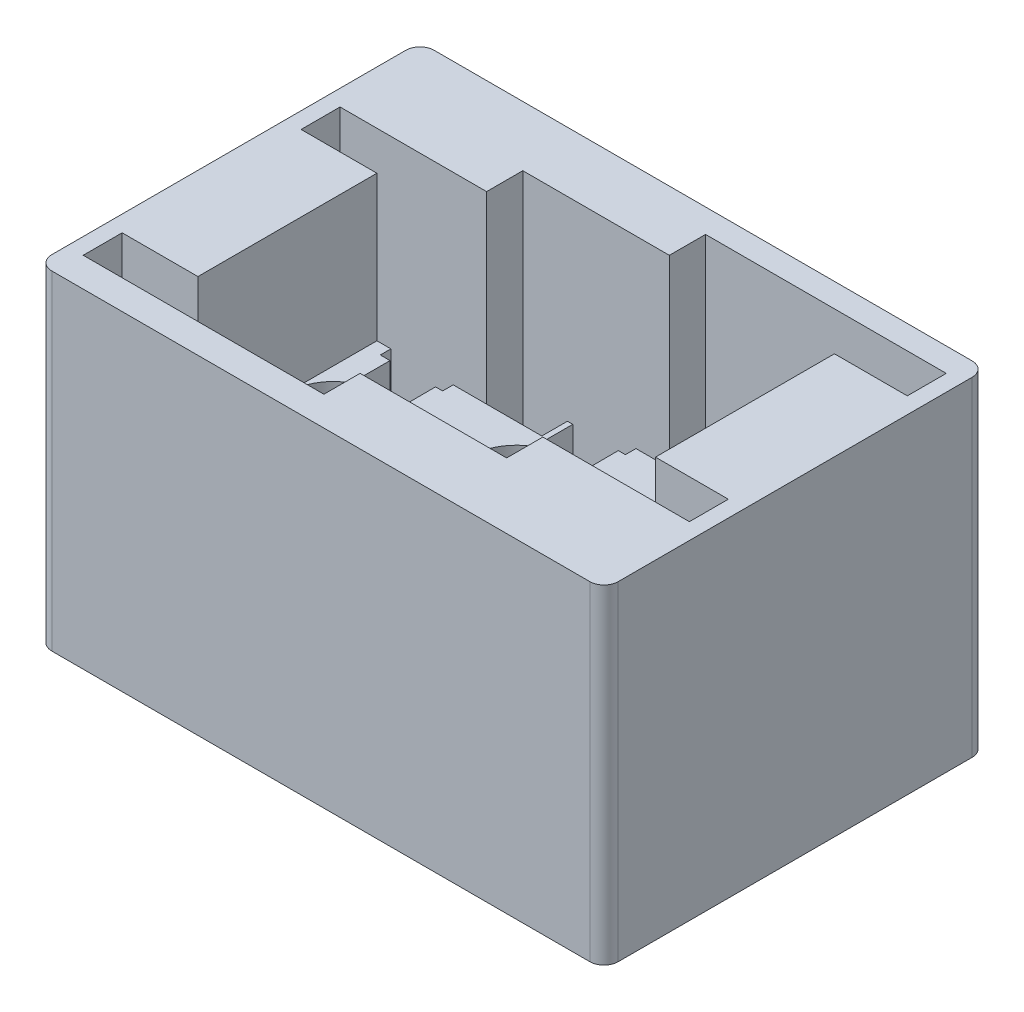
from build123d import *

# Parameters (mm, degrees)
SKETCH1_W                                 = 80
SKETCH1_H                                 = 54
BOSS_EXTRUDE2_DEPTH                       = 46.5
FILLET1_R                                 = 2
TIE_START                                 = 17.648406802
TIE_FIGHTER_LAYING_DOWN_BLANK_DEPTH       = 27
TIE_START_2                               = 3.648406802
TIE_FIGHTER_LAYING_DOWN_BLANK_2_OUTLINE_W = 5.5
TIE_FIGHTER_LAYING_DOWN_BLANK_2_OUTLINE_H = 34
TIE_FIGHTER_LAYING_DOWN_BLANK_2_DEPTH     = 14
TIE_START_3                               = 24.148406802
TIE_FIGHTER_LAYING_DOWN_BLANK_3_DEPTH     = 20.5
TIE_START_4                               = 10.648406802
TIE_FIGHTER_LAYING_DOWN_BLANK_4_OUTLINE_R = 2
TIE_FIGHTER_LAYING_DOWN_BLANK_4_DEPTH     = 7
BODY_MOVE_COPY3_ANGLE                     = 90
SKETCH2_W                                 = 7.700906033
SKETCH2_H                                 = 20.169020688
SKETCH2_W_2                               = 7.700906032
CUT_EXTRUDE1_DEPTH                        = 30
SKETCH3_R                                 = 4
CUT_EXTRUDE2_DEPTH                        = 17
SKETCH4_W                                 = 3.700906032
SKETCH4_H                                 = 16.169020688
SKETCH4_W_2                               = 8.420251913
SKETCH4_H_2                               = 21.281008515
SKETCH4_W_3                               = 8.999653324
SKETCH4_W_4                               = 3.700906033
CUT_EXTRUDE3_DEPTH                        = 27
FILLET2_R                                 = 2
SKETCH5_W                                 = 3.700906033
SKETCH5_H                                 = 16.169020688
SKETCH5_W_2                               = 3.700906032
BOSS_EXTRUDE3_DEPTH                       = 2
SKETCH6_R                                 = 4
CUT_EXTRUDE4_DEPTH                        = 11


with BuildPart() as part:
    # Sketch1 → Boss-Extrude2 (new body)
    with BuildSketch(Plane(origin=(0, 0, 0), x_dir=(1, 0, 0), z_dir=(0, 1, 0))):
        with Locations((40, 27)):
            Rectangle(SKETCH1_W, SKETCH1_H)
    extrude(amount=BOSS_EXTRUDE2_DEPTH)

    # Fillet1
    fillet1_edges = [part.edges().sort_by_distance(p)[0] for p in [
        (0, 23.25, -54),
        (80, 23.25, -54),
        (80, 23.25, 0),
        (0, 23.25, 0),
    ]]
    fillet(fillet1_edges, radius=FILLET1_R)


with BuildPart() as body_2:
    # Tie Fighter Laying Down Blank: read off the stored shape, not the designer's step
    # Tie Fighter Laying Down Blank outline → Tie Fighter Laying Down Blank (new body)
    with BuildSketch(Plane(origin=(0, 0, 0), x_dir=(1, 0, 0), z_dir=(0, 1, 0)).offset(TIE_START)):
        with BuildLine():
            Line((-37.161017612, 22.550360254), (-37.161017612, 23.550360254))
            Line((-37.161017612, 23.550360254), (-31.61325597, 23.529243987))
            ThreePointArc((-31.61325597, 23.529243987), (-26.013035095, 20.32886914), (-20.412814219, 23.529243987))
            Line((-20.412814219, 23.529243987), (-14.865052577, 23.550360254))
            Line((-14.865052577, 23.550360254), (-14.865052577, 22.550360254))
            Line((-14.865052577, 22.550360254), (-13.372530837, 22.550360254))
            Line((-13.372530837, 22.550360254), (-13.372530837, 10.033920638))
            Line((-13.372530837, 10.033920638), (-7.872530837, 10.033920638))
            Line((-7.872530837, 10.033920638), (-7.872530837, 44.033920638))
            Line((-7.872530837, 44.033920638), (-13.372530837, 44.033920638))
            Line((-13.372530837, 44.033920638), (-13.372530837, 31.354739987))
            Line((-13.372530837, 31.354739987), (-14.865052577, 31.354739987))
            Line((-14.865052577, 31.354739987), (-14.865052577, 29.979499621))
            Line((-14.865052577, 29.979499621), (-20.327656693, 29.979499621))
            ThreePointArc((-20.327656693, 29.979499621), (-26.013035095, 33.32886914), (-31.698413496, 29.979499621))
            Line((-31.698413496, 29.979499621), (-37.161017612, 29.979499621))
            Line((-37.161017612, 29.979499621), (-37.161017612, 31.354739987))
            Line((-37.161017612, 31.354739987), (-38.653539352, 31.354739987))
            Line((-38.653539352, 31.354739987), (-38.653539352, 44.033920638))
            Line((-38.653539352, 44.033920638), (-44.153539352, 44.033920638))
            Line((-44.153539352, 44.033920638), (-44.153539352, 10.033920638))
            Line((-44.153539352, 10.033920638), (-38.653539352, 10.033920638))
            Line((-38.653539352, 10.033920638), (-38.653539352, 22.550360254))
            Line((-38.653539352, 22.550360254), (-37.161017612, 22.550360254))
        make_face()
    extrude(amount=TIE_FIGHTER_LAYING_DOWN_BLANK_DEPTH)

    # Tie Fighter Laying Down Blank 2 outline → Tie Fighter Laying Down Blank 2 (add)
    with BuildSketch(Plane(origin=(0, 0, 0), x_dir=(1, 0, 0), z_dir=(0, 1, 0)).offset(TIE_START_2)):
        with Locations((-41.403539352, 27.033920638)):
            Rectangle(TIE_FIGHTER_LAYING_DOWN_BLANK_2_OUTLINE_W, TIE_FIGHTER_LAYING_DOWN_BLANK_2_OUTLINE_H)
        with Locations((-10.622530837, 27.033920638)):
            Rectangle(TIE_FIGHTER_LAYING_DOWN_BLANK_2_OUTLINE_W, TIE_FIGHTER_LAYING_DOWN_BLANK_2_OUTLINE_H)
    extrude(amount=TIE_FIGHTER_LAYING_DOWN_BLANK_2_DEPTH)

    # Tie Fighter Laying Down Blank 3 outline → Tie Fighter Laying Down Blank 3 (add)
    with BuildSketch(Plane(origin=(0, 0, 0), x_dir=(1, 0, 0), z_dir=(0, 1, 0)).offset(TIE_START_3)):
        with BuildLine():
            Line((-31.61325597, 23.529243987), (-37.161017612, 23.550360254))
            Line((-37.161017612, 23.550360254), (-37.161017612, 22.550360254))
            Line((-37.161017612, 22.550360254), (-38.653539352, 22.550360254))
            Line((-38.653539352, 22.550360254), (-38.653539352, 20.32886914))
            Line((-38.653539352, 20.32886914), (-26.013035094, 20.32886914))
            ThreePointArc((-26.013035094, 20.32886914), (-29.238127071, 21.18539665), (-31.61325597, 23.529243987))
        make_face()
        with BuildLine():
            ThreePointArc((-20.412814219, 23.529243987), (-22.787943118, 21.18539665), (-26.013035094, 20.32886914))
            Line((-26.013035094, 20.32886914), (-13.372530837, 20.32886914))
            Line((-13.372530837, 20.32886914), (-13.372530837, 22.550360254))
            Line((-13.372530837, 22.550360254), (-14.865052577, 22.550360254))
            Line((-14.865052577, 22.550360254), (-14.865052577, 23.550360254))
            Line((-14.865052577, 23.550360254), (-20.412814219, 23.529243987))
        make_face()
        with BuildLine():
            Line((-38.653539352, 33.32886914), (-38.653539352, 31.354739987))
            Line((-38.653539352, 31.354739987), (-37.161017612, 31.354739987))
            Line((-37.161017612, 31.354739987), (-37.161017612, 29.979499621))
            Line((-37.161017612, 29.979499621), (-31.698413496, 29.979499621))
            ThreePointArc((-31.698413496, 29.979499621), (-29.31234577, 32.429275292), (-26.013035095, 33.32886914))
            Line((-26.013035095, 33.32886914), (-38.653539352, 33.32886914))
        make_face()
        with BuildLine():
            Line((-13.372530837, 33.32886914), (-26.013035095, 33.32886914))
            ThreePointArc((-26.013035095, 33.32886914), (-22.713724419, 32.429275292), (-20.327656693, 29.979499621))
            Line((-20.327656693, 29.979499621), (-14.865052577, 29.979499621))
            Line((-14.865052577, 29.979499621), (-14.865052577, 31.354739987))
            Line((-14.865052577, 31.354739987), (-13.372530837, 31.354739987))
            Line((-13.372530837, 31.354739987), (-13.372530837, 33.32886914))
        make_face()
    extrude(amount=TIE_FIGHTER_LAYING_DOWN_BLANK_3_DEPTH)

    # Tie Fighter Laying Down Blank 4 outline → Tie Fighter Laying Down Blank 4 (add)
    with BuildSketch(Plane(origin=(0, 0, 0), x_dir=(1, 0, 0), z_dir=(0, 1, 0)).offset(TIE_START_4)):
        with Locations((-26.013035095, 26.82886914)):
            Circle(TIE_FIGHTER_LAYING_DOWN_BLANK_4_OUTLINE_R)
    extrude(amount=TIE_FIGHTER_LAYING_DOWN_BLANK_4_DEPTH)


with BuildPart() as body_2_1:
    # Body-Move/Copy2: read off the stored shape, not the designer's step
    # Body-Move/Copy2: moved
    add(body_2.part.moved(Location((0, 1.8515932, 0))))


with BuildPart() as body_2_2:
    # Body-Move/Copy3: moved
    add(body_2_1.part.rotate(Axis((-26.013075057, 0, -27.033920638), (0, 1, 0)), BODY_MOVE_COPY3_ANGLE))


with BuildPart() as body_2_3:
    # Body-Move/Copy4: moved
    add(body_2_2.part.moved(Location((45.307676883, 0, 6.774371597))))


with BuildPart() as body_3:
    # Body-Move/Copy6: read off the stored shape, not the designer's step
    # Body-Move/Copy6: copy of body 2
    add(body_2_3.part.moved(Location((41.4018121, 0, -10.2239757))))


with BuildPart() as body_4:
    # Body-Move_Copy6 2: copy of body 2
    add(body_2_3.part.moved(Location((20.700906, 0, -5.1119878))))


with BuildPart() as body_3_1:
    # Body-Move/Copy7: read off the stored shape, not the designer's step
    # Body-Move/Copy7: moved
    add(body_3.part.moved(Location((0, 0, -2.018363))))


with BuildPart() as body_4_1:
    # Body-Move_Copy7 2: moved
    add(body_4.part.moved(Location((0, 0, -2.018363))))


with BuildPart() as body_2_4:
    # Body-Move_Copy7 3: moved
    add(body_2_3.part.moved(Location((0, 0, -2.018363))))


with BuildPart() as part_1:
    add(part.part)

    # Intersect1: read off the stored shape, not the designer's step
    # Intersect1: cut body 3, body 4, body 2
    add(body_3_1.part, mode=Mode.SUBTRACT)
    add(body_4_1.part, mode=Mode.SUBTRACT)
    add(body_2_4.part, mode=Mode.SUBTRACT)

    # Sketch2 → Cut-Extrude1 (cut)
    with BuildSketch(Plane(origin=(0, 26, 0), x_dir=(1, 0, 0), z_dir=(0, 1, 0))):
        with Locations((29.850106341, 24.833945924)):
            Rectangle(SKETCH2_W, SKETCH2_H)
        with Locations((50.551012373, 29.945933752)):
            Rectangle(SKETCH2_W_2, SKETCH2_H)
    extrude(amount=CUT_EXTRUDE1_DEPTH, mode=Mode.SUBTRACT)

    # Sketch3 → Cut-Extrude2 (cut)
    # profile 1 of 3: a face of its own
    with BuildSketch(Plane.XZ):
        Polygon((38.294601826, -32.918456268), (2, -32.918456268), (2, -11.637447753), (20.995507859, -11.637447753), (20.995507859, -16.74943558), (41.696413892, -16.74943558), (41.696413892, -21.861423408), (78, -21.861423408), (78, -43.142431923), (58.995507859, -43.142431923), (58.995507859, -38.030444096), (38.294601826, -38.030444096), align=None)
        with Locations(Location((60.901465389, -32.501927666, 0), (0, 0, 270))):
            Circle(SKETCH3_R, mode=Mode.SUBTRACT)
        with Locations(Location((40.200559357, -27.389939838, 0), (0, 0, 270))):
            Circle(SKETCH3_R, mode=Mode.SUBTRACT)
        with Locations(Location((19.499653324, -22.277952011, 0), (0, 0, 270))):
            Circle(SKETCH3_R, mode=Mode.SUBTRACT)
    # profile 2 of 3: a face of its own
    with BuildSketch(Plane.XZ):
        Polygon((2.294601826, -42.418456268), (20.995507859, -42.418456268), (20.995507859, -47.530444096), (41.696413892, -47.530444096), (41.696413892, -50.642391961), (41.696413892, -52), (2, -52), (2, -42.418456268), align=None)
    # profile 3 of 3: a face of its own
    with BuildSketch(Plane.XZ):
        Polygon((77.696413892, -12.361423408), (58.995507859, -12.361423408), (58.995507859, -7.24943558), (38.294601826, -7.24943558), (38.294601826, -2), (78, -2), (78, -12.361383446), align=None)
    extrude(amount=-CUT_EXTRUDE2_DEPTH, mode=Mode.SUBTRACT)

    # Sketch4 → Cut-Extrude3 (cut)
    with BuildSketch(Plane.XZ.offset(-17)):
        Polygon((78, -12.361423408), (58.995507859, -12.361423408), (58.995507859, -7.24943558), (38.294601826, -7.24943558), (38.294601826, -2), (58.995507859, -2), (78, -2), align=None)
        Polygon((2, -42.418456268), (20.995507859, -42.418456268), (20.995507859, -47.530444096), (41.696413892, -47.530444096), (41.696413892, -52), (20.995507859, -52), (2, -52), align=None)
        with Locations((50.551012373, -29.945933752)):
            Rectangle(SKETCH4_W, SKETCH4_H)
        with Locations((73.611591346, -32.501927666)):
            Rectangle(SKETCH4_W_2, SKETCH4_H_2)
        with Locations((6.499826662, -22.277952011)):
            Rectangle(SKETCH4_W_3, SKETCH4_H_2)
        with Locations((29.850106341, -24.833945924)):
            Rectangle(SKETCH4_W_4, SKETCH4_H)
    extrude(amount=-CUT_EXTRUDE3_DEPTH, mode=Mode.SUBTRACT)

    # Fillet2
    fillet2_edges = [part_1.edges().sort_by_distance(p)[0] for p in [
        (2, 22, -52),
        (78, 22, -2),
    ]]
    fillet(fillet2_edges, radius=FILLET2_R)

    # Sketch5 → Boss-Extrude3 (add)
    with BuildSketch(Plane(origin=(0, 26, 0), x_dir=(1, 0, 0), z_dir=(0, 1, 0))):
        with Locations((29.850106341, 24.833945924)):
            Rectangle(SKETCH5_W, SKETCH5_H)
        with Locations((50.551012373, 29.945933752)):
            Rectangle(SKETCH5_W_2, SKETCH5_H)
    extrude(amount=-BOSS_EXTRUDE3_DEPTH)

    # Sketch6 → Cut-Extrude4 (cut)
    with BuildSketch(Plane.XZ):
        with Locations(Location((19.499653324, -22.277952011, 0), (0, 0, 270))):
            Circle(SKETCH6_R)
        with Locations(Location((40.200559357, -27.389939838, 0), (0, 0, 270))):
            Circle(SKETCH6_R)
        with Locations(Location((60.901465389, -32.501927666, 0), (0, 0, 270))):
            Circle(SKETCH6_R)
    extrude(amount=-CUT_EXTRUDE4_DEPTH, mode=Mode.SUBTRACT)


solid = part_1.part
